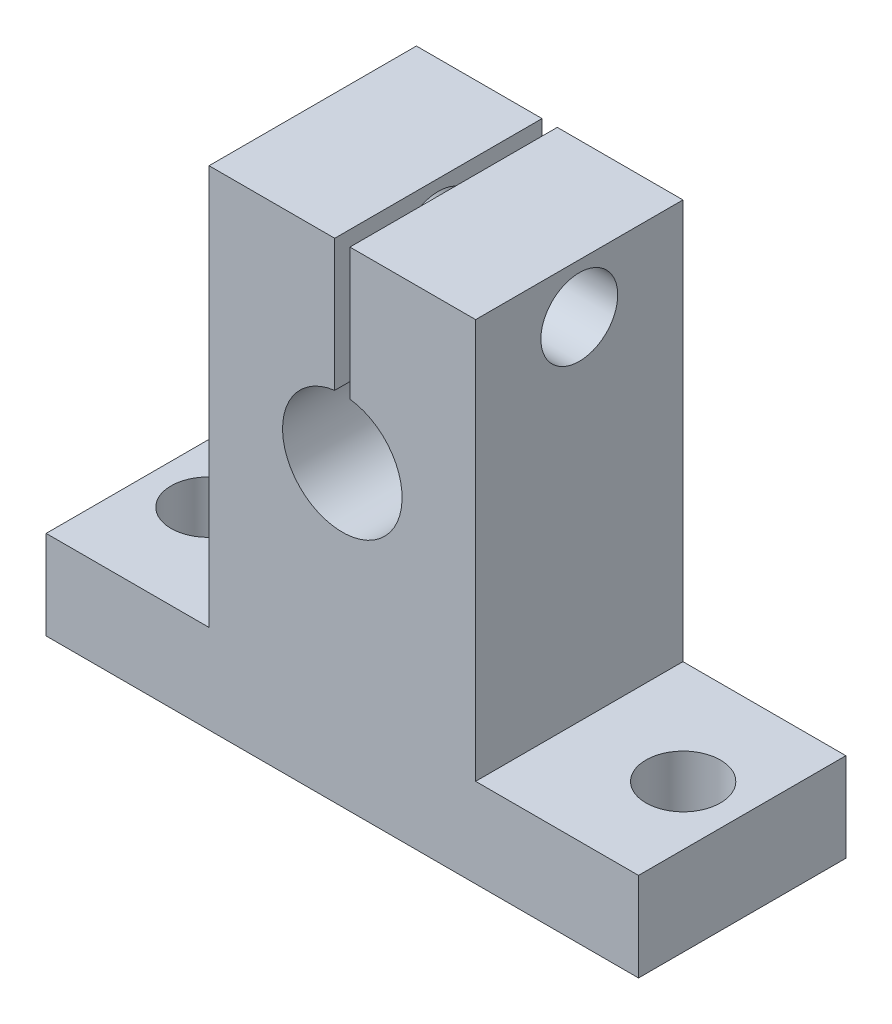
from build123d import *

# Parameters (mm, degrees)
SALIENTE_EXTRUIR1_DEPTH = 14
CROQUIS2_R              = 4.035649311
CORTAR_EXTRUIR1_DEPTH   = 14
CROQUIS5_R              = 2.497749653
CORTAR_EXTRUIR2_DEPTH   = 14
CROQUIS7_R              = 2.514867633
CORTAR_EXTRUIR3_DEPTH   = 14
CROQUIS8_W              = 1.02892534
CROQUIS8_H              = 10.439450899
CORTAR_EXTRUIR4_DEPTH   = 14
CROQUIS9_R              = 2.593975345
CORTAR_EXTRUIR5_DEPTH   = 37.745892113


with BuildPart() as part:
    # Croquis1 → Saliente-Extruir1 (new body)
    with BuildSketch(Plane.XY):
        Polygon((-2.000386176, 17.69916911), (15.999613824, 17.69916911), (15.999613824, -9.30083089), (26.999613824, -9.30083089), (26.999613824, -15.30083089), (15.999613824, -15.30083089), (-2.000386176, -15.30083089), (-13.000386176, -15.30083089), (-13.000386176, -9.30083089), (-2.000386176, -9.30083089), align=None)
    extrude(amount=SALIENTE_EXTRUIR1_DEPTH)

    # Croquis2 → Cortar-Extruir1 (cut)
    with BuildSketch(Plane.XY.offset(14)):
        with Locations((6.999613824, 4.803097651)):
            Circle(CROQUIS2_R)
    extrude(amount=-CORTAR_EXTRUIR1_DEPTH, mode=Mode.SUBTRACT)

    # Croquis5 → Cortar-Extruir2 (cut)
    with BuildSketch(Plane(origin=(0, -9.30083089, 0), x_dir=(1, 0, 0), z_dir=(0, 1, 0))):
        with Locations((-9.06576441, -7)):
            Circle(CROQUIS5_R)
    extrude(amount=-CORTAR_EXTRUIR2_DEPTH, mode=Mode.SUBTRACT)

    # Croquis7 → Cortar-Extruir3 (cut)
    with BuildSketch(Plane(origin=(0, -9.30083089, 0), x_dir=(1, 0, 0), z_dir=(0, 1, 0))):
        with Locations((23.014515722, -7)):
            Circle(CROQUIS7_R)
    extrude(amount=-CORTAR_EXTRUIR3_DEPTH, mode=Mode.SUBTRACT)

    # Croquis8 → Cortar-Extruir4 (cut)
    with BuildSketch(Plane.XY.offset(14)):
        with Locations((6.999613824, 13.435682)):
            Rectangle(CROQUIS8_W, CROQUIS8_H)
    extrude(amount=-CORTAR_EXTRUIR4_DEPTH, mode=Mode.SUBTRACT)

    # Croquis9 → Cortar-Extruir5 (cut, through all)
    with BuildSketch(Plane.ZY.offset(2.000386176)):
        with Locations((7, 14.351263228)):
            Circle(CROQUIS9_R)
    extrude(amount=-CORTAR_EXTRUIR5_DEPTH, mode=Mode.SUBTRACT)


solid = part.part
